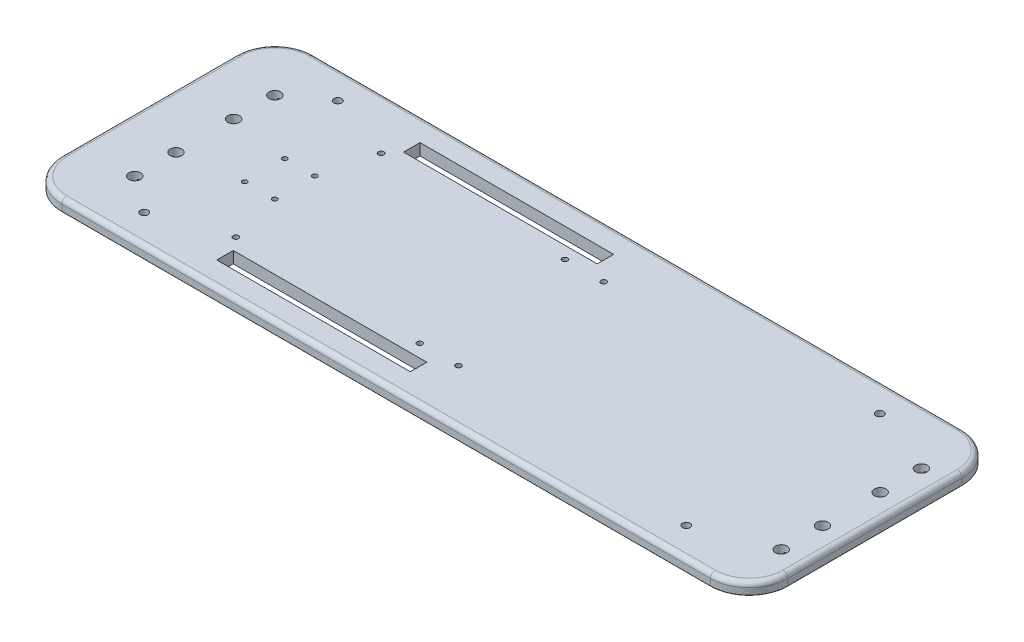
from build123d import *

# Parameters (mm, degrees)
CROQUIS1_W              = 375
CROQUIS1_H              = 130
SALIENTE_EXTRUIR1_DEPTH = 6
CROQUIS2_R              = 3
CROQUIS2_R_2            = 1.5
CORTAR_EXTRUIR1_DEPTH   = 10
CROQUIS3_R              = 3
CROQUIS3_R_2            = 1.5
CORTAR_EXTRUIR2_DEPTH   = 10
CROQUIS4_W              = 2.5
CROQUIS4_H              = 11
CORTAR_EXTRUIR3_DEPTH   = 2.5
REDONDEO1_R             = 0.2
REDONDEO2_R             = 20
REDONDEO3_R             = 2.5
CROQUIS5_R              = 2
CORTAR_EXTRUIR4_DEPTH   = 10
CROQUIS6_W              = 100
CROQUIS6_H              = 8.5
CORTAR_EXTRUIR5_DEPTH   = 10
CROQUIS7_R              = 1.25
CROQUIS7_R_2            = 1.4
CORTAR_EXTRUIR6_DEPTH   = 3
CROQUIS8_R              = 3
CORTAR_EXTRUIR7_DEPTH   = 8


with BuildPart() as part:
    # Croquis1 → Saliente-Extruir1 (new body)
    with BuildSketch(Plane(origin=(0, 0, 0), x_dir=(1, 0, 0), z_dir=(0, 1, 0))):
        Rectangle(CROQUIS1_W, CROQUIS1_H)
    extrude(amount=SALIENTE_EXTRUIR1_DEPTH)

    # Croquis2 → Cortar-Extruir1 (cut)
    with BuildSketch(Plane(origin=(0, 6, 0), x_dir=(1, 0, 0), z_dir=(0, 1, 0))):
        with Locations(Location((-158.7, -36.2, 0), (0, 0, 270))):
            Circle(CROQUIS2_R)
        with Locations(Location((-158.7, -14.9, 0), (0, 0, 270))):
            Circle(CROQUIS2_R_2)
        with Locations(Location((-158.7, 36.2, 0), (0, 0, 90))):
            Circle(CROQUIS2_R)
        with Locations(Location((-158.7, 14.9, 0), (0, 0, 90))):
            Circle(CROQUIS2_R_2)
    extrude(amount=-CORTAR_EXTRUIR1_DEPTH, mode=Mode.SUBTRACT)

    # Croquis3 → Cortar-Extruir2 (cut)
    with BuildSketch(Plane(origin=(0, 6, 0), x_dir=(1, 0, 0), z_dir=(0, 1, 0))):
        with Locations(Location((175.3, -36.2, 0), (0, 0, 270))):
            Circle(CROQUIS3_R)
        with Locations(Location((175.3, -14.9, 0), (0, 0, 270))):
            Circle(CROQUIS3_R_2)
        with Locations(Location((175.3, 14.9, 0), (0, 0, 90))):
            Circle(CROQUIS3_R_2)
        with Locations(Location((175.3, 36.2, 0), (0, 0, 90))):
            Circle(CROQUIS3_R)
    extrude(amount=-CORTAR_EXTRUIR2_DEPTH, mode=Mode.SUBTRACT)

    # Croquis4 → Cortar-Extruir3 (cut)
    with BuildSketch(Plane.XZ):
        with Locations((175.3, 36.2)):
            Rectangle(CROQUIS4_W, CROQUIS4_H)
        with Locations((-158.7, 36.2)):
            Rectangle(CROQUIS4_W, CROQUIS4_H)
        with Locations((175.3, -36.2)):
            Rectangle(CROQUIS4_W, CROQUIS4_H)
        with Locations((-158.7, -36.2)):
            Rectangle(CROQUIS4_W, CROQUIS4_H)
    extrude(amount=-CORTAR_EXTRUIR3_DEPTH, mode=Mode.SUBTRACT)

    # Redondeo1
    redondeo1_edges = [part.edges().sort_by_distance(p)[0] for p in [
        (176.55, 0, -40.313589014),
        (176.55, 0, -32.086410986),
        (175.3, 0, -30.7),
        (174.05, 0, -32.086410986),
        (175.3, 2.5, -41.7),
        (175.3, 2.5, -30.7),
        (174.05, 2.5, 40.313589014),
        (174.05, 2.5, 32.086410986),
        (176.55, 2.5, 32.086410986),
        (176.55, 2.5, 40.313589014),
        (174.05, 0, 32.086410986),
        (175.3, 0, 30.7),
        (176.55, 0, 32.086410986),
        (176.55, 0, 40.313589014),
        (175.3, 0, 41.7),
        (174.05, 0, 40.313589014),
        (175.3, 2.5, 30.7),
        (175.3, 2.5, 41.7),
        (-157.45, 2.5, 32.086410986),
        (-157.45, 2.5, 40.313589014),
        (-159.95, 2.5, 40.313589014),
        (-159.95, 2.5, 32.086410986),
        (-159.95, 0, 40.313589014),
        (-157.45, 0, 40.313589014),
        (-158.7, 0, 41.7),
        (-157.45, 0, 32.086410986),
        (-159.95, 0, 32.086410986),
        (-158.7, 0, 30.7),
        (-158.7, 2.5, 30.7),
        (-158.7, 2.5, 41.7),
        (-155.7, 0, 36.2),
        (-158.7, 0, -13.4),
        (-155.7, 0, -36.2),
        (-158.7, 0, 13.4),
        (178.3, 0, 36.2),
        (175.3, 0, 13.4),
        (175.3, 0, -13.4),
        (178.3, 0, -36.2),
        (0, 0, 65),
        (-187.5, 0, 0),
        (0, 0, -65),
        (172.3, 0, 36.2),
        (174.660286817, 2.5, 39.131001031),
        (176.55, 1.25, 38.927178029),
        (174.05, 1.25, 38.927178029),
        (175.3, 2.5, 33.2),
        (176.55, 1.25, 33.472821971),
        (174.05, 1.25, 33.472821971),
        (187.5, 0, 0),
        (172.3, 0, -36.2),
        (175.3, 2.5, -33.2),
        (176.55, 1.25, -33.472821971),
        (174.05, 1.25, -33.472821971),
        (175.939713183, 2.5, -39.131001031),
        (176.55, 1.25, -38.927178029),
        (174.05, 1.25, -38.927178029),
        (-161.7, 0, 36.2),
        (-158.7, 2.5, 33.2),
        (-159.95, 1.25, 33.472821971),
        (-157.45, 1.25, 33.472821971),
        (-159.339713183, 2.5, 39.131001031),
        (-159.95, 1.25, 38.927178029),
        (-157.45, 1.25, 38.927178029),
        (-161.7, 0, -36.2),
        (-158.7, 2.5, -33.2),
        (-157.45, 1.25, -33.472821971),
        (-159.95, 1.25, -33.472821971),
        (-158.060286817, 2.5, -39.131001031),
        (-157.45, 1.25, -38.927178029),
        (-159.95, 1.25, -38.927178029),
        (-159.95, 2.5, -32.086410986),
        (-159.95, 2.5, -40.313589014),
        (-157.45, 2.5, -40.313589014),
        (-157.45, 2.5, -32.086410986),
        (-159.95, 0, -40.313589014),
        (-158.7, 0, -41.7),
        (-157.45, 0, -40.313589014),
        (-157.45, 0, -32.086410986),
        (-158.7, 0, -30.7),
        (-159.95, 0, -32.086410986),
        (-158.7, 2.5, -41.7),
        (-158.7, 2.5, -30.7),
        (174.05, 2.5, -32.086410986),
        (174.05, 2.5, -40.313589014),
        (176.55, 2.5, -40.313589014),
        (176.55, 2.5, -32.086410986),
        (174.05, 0, -40.313589014),
        (175.3, 0, -41.7),
    ]]
    fillet(redondeo1_edges, radius=REDONDEO1_R)

    # Redondeo2
    # the kernel refuses this fillet: 20 mm, written as the material it takes off along each edge
    with BuildSketch(Plane(origin=(167.5, 0, 45), x_dir=(1, 0, 0), z_dir=(0, 0, -1))) as redondeo2_piece_1:
        with BuildLine():
            CenterArc((19.8, -0.2), 0.2, 0, 90)
            Line((20, -0.2), (20, 0))
            Line((20, 0), (19.8, 0))
        make_face()
    revolve(axis=Axis((167.5, 0, 45), (0, -1, 0)), revolution_arc=90, mode=Mode.SUBTRACT)
    with BuildSketch(Plane(origin=(-167.5, 0, 45), x_dir=(0, 0, 1), z_dir=(1, 0, 0))) as redondeo2_piece_2:
        with BuildLine():
            CenterArc((19.8, -0.2), 0.2, 0, 90)
            Line((20, -0.2), (20, 0))
            Line((20, 0), (19.8, 0))
        make_face()
    revolve(axis=Axis((-167.5, 0, 45), (0, -1, 0)), revolution_arc=90, mode=Mode.SUBTRACT)
    with BuildSketch(Plane(origin=(167.5, 0, -45), x_dir=(0, 0, -1), z_dir=(-1, 0, 0))) as redondeo2_piece_3:
        with BuildLine():
            CenterArc((19.8, -0.2), 0.2, 0, 90)
            Line((20, -0.2), (20, 0))
            Line((20, 0), (19.8, 0))
        make_face()
    revolve(axis=Axis((167.5, 0, -45), (0, -1, 0)), revolution_arc=90, mode=Mode.SUBTRACT)
    with BuildSketch(Plane(origin=(-167.5, 0, -45), x_dir=(-1, 0, 0), z_dir=(0, 0, 1))) as redondeo2_piece_4:
        with BuildLine():
            CenterArc((19.8, -0.2), 0.2, 0, 90)
            Line((20, -0.2), (20, 0))
            Line((20, 0), (19.8, 0))
        make_face()
    revolve(axis=Axis((-167.5, 0, -45), (0, -1, 0)), revolution_arc=90, mode=Mode.SUBTRACT)
    with BuildSketch(Plane(origin=(187.5, 0, 65), x_dir=(-1, 0, 0), z_dir=(0, 1, 0)), Plane(origin=(-187.5, 0, -65), x_dir=(1, 0, 0), z_dir=(0, 1, 0)), Plane(origin=(187.5, 0, -65), x_dir=(0, 0, 1), z_dir=(0, 1, 0))) as redondeo2_piece_5:
        with BuildLine():
            CenterArc((REDONDEO2_R, -REDONDEO2_R), REDONDEO2_R, 90, 90)
            Line((0, -REDONDEO2_R), (0, 0))
            Line((0, 0), (REDONDEO2_R, 0))
        make_face()
    extrude(amount=56, mode=Mode.SUBTRACT)
    with BuildSketch(Plane(origin=(-187.5, 0, 65), x_dir=(1, 0, 0), z_dir=(0, 1, 0))) as redondeo2_piece_6:
        with BuildLine():
            CenterArc((REDONDEO2_R, REDONDEO2_R), REDONDEO2_R, 180, 90)
            Line((0, REDONDEO2_R), (0, 0))
            Line((0, 0), (REDONDEO2_R, 0))
        make_face()
    extrude(amount=56, mode=Mode.SUBTRACT)

    # Redondeo3
    redondeo3_edges = [part.edges().sort_by_distance(p)[0] for p in [
        (187.5, 6, 0),
        (0, 6, 65),
        (0, 6, -65),
        (-187.5, 6, 0),
        (-181.642135624, 6, 59.142135624),
        (-181.642135624, 6, -59.142135624),
        (181.642135624, 6, -59.142135624),
        (181.642135624, 6, 59.142135624),
    ]]
    fillet(redondeo3_edges, radius=REDONDEO3_R)

    # Croquis5 → Cortar-Extruir4 (cut)
    with BuildSketch(Plane(origin=(0, 6, 0), x_dir=(1, 0, 0), z_dir=(0, 1, 0))):
        with Locations(Location((-140, 50, 0), (0, 0, 270))):
            Circle(CROQUIS5_R)
        with Locations(Location((-140, -50, 0), (0, 0, 90))):
            Circle(CROQUIS5_R)
        with Locations(Location((140, -50, 0), (0, 0, 270))):
            Circle(CROQUIS5_R)
        with Locations(Location((140, 50, 0), (0, 0, 90))):
            Circle(CROQUIS5_R)
    extrude(amount=-CORTAR_EXTRUIR4_DEPTH, mode=Mode.SUBTRACT)

    # Croquis6 → Cortar-Extruir5 (cut)
    with BuildSketch(Plane(origin=(0, 6, 0), x_dir=(1, 0, 0), z_dir=(0, 1, 0))):
        with Locations((-50, -48.25)):
            Rectangle(CROQUIS6_W, CROQUIS6_H)
        with Locations((-50, 48.25)):
            Rectangle(CROQUIS6_W, CROQUIS6_H)
    extrude(amount=-CORTAR_EXTRUIR5_DEPTH, mode=Mode.SUBTRACT)

    # Croquis7 → Cortar-Extruir6 (cut)
    with BuildSketch(Plane(origin=(0, 6, 0), x_dir=(1, 0, 0), z_dir=(0, 1, 0))):
        with Locations(Location((-127.8, 10.4, 0), (0, 0, 270))):
            Circle(CROQUIS7_R)
        with Locations(Location((-112.3, 10.4, 0), (0, 0, 270))):
            Circle(CROQUIS7_R)
        with Locations(Location((-112.3, -10.3, 0), (0, 0, 270))):
            Circle(CROQUIS7_R)
        with Locations(Location((-127.8, -10.3, 0), (0, 0, 270))):
            Circle(CROQUIS7_R)
        with Locations(Location((-105.3, 37.65, 0), (0, 0, 270))):
            Circle(CROQUIS7_R_2)
        with Locations(Location((-10.3, 37.65, 0), (0, 0, 270))):
            Circle(CROQUIS7_R_2)
        with Locations(Location((9.7, 37.65, 0), (0, 0, 270))):
            Circle(CROQUIS7_R_2)
        with Locations(Location((9.7, -37.35, 0), (0, 0, 270))):
            Circle(CROQUIS7_R_2)
        with Locations(Location((-10.3, -37.35, 0), (0, 0, 270))):
            Circle(CROQUIS7_R_2)
        with Locations(Location((-105.3, -37.35, 0), (0, 0, 270))):
            Circle(CROQUIS7_R_2)
    extrude(amount=-CORTAR_EXTRUIR6_DEPTH, mode=Mode.SUBTRACT)

    # Croquis8 → Cortar-Extruir7 (cut)
    with BuildSketch(Plane(origin=(0, 6, 0), x_dir=(1, 0, 0), z_dir=(0, 1, 0))):
        with Locations(Location((-158.7, 14.9, 0), (0, 0, 270))):
            Circle(CROQUIS8_R)
        with Locations(Location((-158.7, -14.9, 0), (0, 0, 270))):
            Circle(CROQUIS8_R)
        with Locations(Location((175.3, 14.9, 0), (0, 0, 270))):
            Circle(CROQUIS8_R)
        with Locations(Location((175.3, -14.9, 0), (0, 0, 270))):
            Circle(CROQUIS8_R)
    extrude(amount=-CORTAR_EXTRUIR7_DEPTH, mode=Mode.SUBTRACT)


solid = part.part
